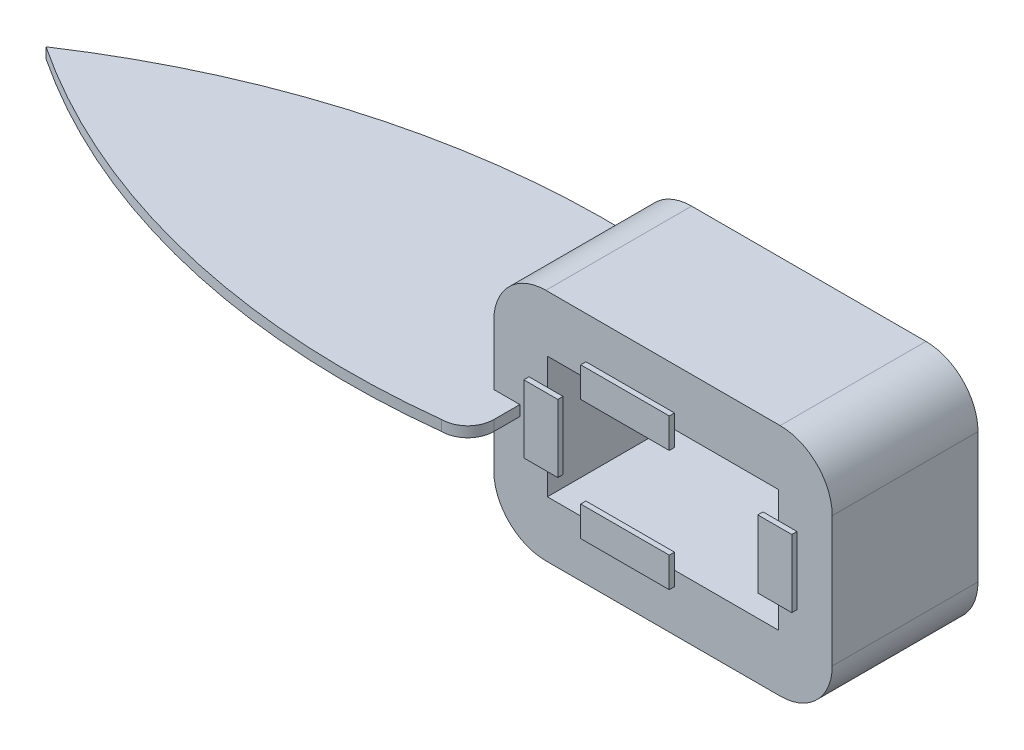
from build123d import *

# Parameters (mm, degrees)
SKETCH_1_W           = 65
SKETCH_1_H           = 45
EXTRUDE_1_DEPTH      = 28
SKETCH_2_W           = 44.4
SKETCH_2_H           = 23.4
CUT_EXTRUDE_1_DEPTH  = 39
FILLET_1_R           = 10
FILLET_2_R           = 10
FILLET_3_R           = 10
FILLET_4_R           = 10
EXTRUDE_6_DEPTH      = 1
EXTRUDE_6_2_DEPTH    = 1
EXTRUDE_6_3_DEPTH    = 1
SKETCH_10_W          = 17
SKETCH_10_H          = 5.754584259
EXTRUDE_6_4_DEPTH    = 1
SKETCH_20_W          = 5.002637397
SKETCH_20_H          = 2
EXTRUDE_7_DEPTH      = 10
SKETCH_21_W          = 5.00232547
SKETCH_21_H          = 2
EXTRUDE_8_DEPTH      = 10
EXTRUDE_9_DEPTH      = 1
EXTRUDE_9_DEPTH_BACK = 1
FILLET_5_R           = 5
FILLET_6_R           = 5


with BuildPart() as part:
    # 草圖1 → 填料-伸長1 (new body)
    with BuildSketch(Plane.XY):
        with Locations((-27.434655272, 0)):
            Rectangle(SKETCH_1_W, SKETCH_1_H)
    extrude(amount=EXTRUDE_1_DEPTH)

    # 草圖2 → 除料-伸長1 (cut)
    with BuildSketch(Plane.XY):
        with Locations((-27.434655272, 0)):
            Rectangle(SKETCH_2_W, SKETCH_2_H)
    extrude(amount=CUT_EXTRUDE_1_DEPTH, mode=Mode.SUBTRACT)

    # 圓角1
    fillet_1_edges = [part.edges().sort_by_distance(p)[0] for p in [
        (-59.934655272, -22.5, 14),
    ]]
    fillet(fillet_1_edges, radius=FILLET_1_R)

    # 圓角2
    fillet_2_edges = [part.edges().sort_by_distance(p)[0] for p in [
        (-59.934655272, 22.5, 14),
    ]]
    fillet(fillet_2_edges, radius=FILLET_2_R)

    # 圓角3
    fillet_3_edges = [part.edges().sort_by_distance(p)[0] for p in [
        (5.065344728, 22.5, 14),
    ]]
    fillet(fillet_3_edges, radius=FILLET_3_R)

    # 圓角4
    fillet_4_edges = [part.edges().sort_by_distance(p)[0] for p in [
        (5.065344728, -22.5, 14),
    ]]
    fillet(fillet_4_edges, radius=FILLET_4_R)

    # 草圖20 → 填料-伸長7 (add)
    with BuildSketch(Plane.XY.offset(28)):
        with Locations((-57.433336574, 0)):
            Rectangle(SKETCH_20_W, SKETCH_20_H)
    extrude(amount=EXTRUDE_7_DEPTH)

    # 草圖21 → 填料-伸長8 (add)
    with BuildSketch(Plane(origin=(0, 0, 0), x_dir=(-1, 0, 0), z_dir=(0, 0, -1))):
        with Locations((57.433492537, 0)):
            Rectangle(SKETCH_21_W, SKETCH_21_H)
    extrude(amount=EXTRUDE_8_DEPTH)

    # 草圖22 → 填料-伸長9 (add, two sides: drawn at the far end of the back side and taken through both)
    with BuildSketch(Plane(origin=(0, 0, 0), x_dir=(1, 0, 0), z_dir=(0, 1, 0)).offset(-EXTRUDE_9_DEPTH_BACK)):
        with BuildLine():
            Line((-59.934655272, 10), (-59.934655272, -38))
            ThreePointArc((-59.934655272, -38), (-112.055707444, -34.837717383), (-159.934655272, -14))
            ThreePointArc((-159.934655272, -14), (-112.055707444, 6.837717383), (-59.934655272, 10))
        make_face()
    extrude(amount=EXTRUDE_9_DEPTH + EXTRUDE_9_DEPTH_BACK)

    # 圓角5
    fillet_5_edges = [part.edges().sort_by_distance(p)[0] for p in [
        (-54.932329802, 0, -10),
    ]]
    fillet(fillet_5_edges, radius=FILLET_5_R)

    # 圓角6
    fillet_6_edges = [part.edges().sort_by_distance(p)[0] for p in [
        (-54.932017875, 0, 38),
    ]]
    fillet(fillet_6_edges, radius=FILLET_6_R)


with BuildPart() as body_2:
    # 草圖10 → 填料-伸長6 (new body)
    with BuildSketch(Plane.XY.offset(29)):
        Polygon((-49.634655272, 6.5), (-53.165057103, 6.5), (-53.165057103, -6.5), (-46.634655272, -6.5), (-46.634655272, 6.5), align=None)
    extrude(amount=-EXTRUDE_6_DEPTH)


with BuildPart() as body_3:
    # 草圖10 → Extrude 6 2 (new body)
    with BuildSketch(Plane.XY.offset(29)):
        Polygon((-42.234655272, -11.7), (-42.234655272, -8.7), (-25.234655272, -8.7), (-25.234655272, -14.454584259), (-42.234655272, -14.454584259), align=None)
    extrude(amount=-EXTRUDE_6_2_DEPTH)


with BuildPart() as body_4:
    # 草圖10 → Extrude 6 3 (new body)
    with BuildSketch(Plane.XY.offset(29)):
        Polygon((-8.234655272, 6.5), (-8.234655272, -6.5), (-5.234655272, -6.5), (-1.70425344, -6.5), (-1.70425344, 6.5), align=None)
    extrude(amount=-EXTRUDE_6_3_DEPTH)


with BuildPart() as body_5:
    # 草圖10 → Extrude 6 4 (new body)
    with BuildSketch(Plane.XY.offset(29)):
        with Locations((-33.734655272, 11.57729213)):
            Rectangle(SKETCH_10_W, SKETCH_10_H)
    extrude(amount=-EXTRUDE_6_4_DEPTH)


solid = Compound([part.part, body_2.part, body_3.part, body_4.part, body_5.part])
